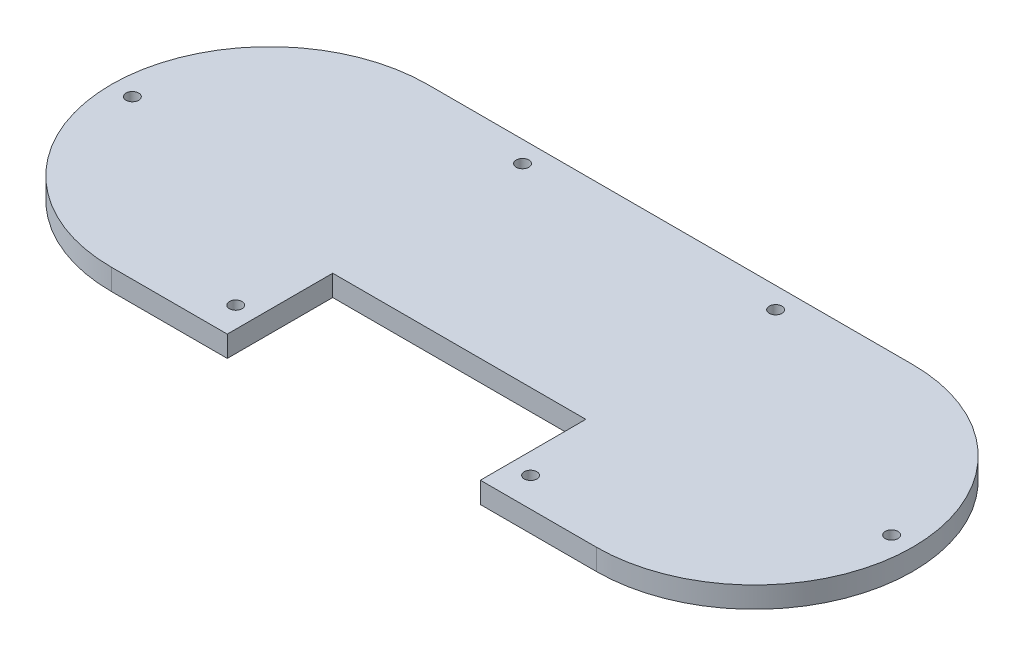
from build123d import *

# Parameters (mm, degrees)
SKETCH1_R  = 1.5
BODY_DEPTH = 5


with BuildPart() as part:
    # Sketch1 → body (new body)
    with BuildSketch(Plane(origin=(0, 0, 0), x_dir=(1, 0, 0), z_dir=(0, 1, 0))):
        with BuildLine():
            Line((-57.5, 37.5), (57.5, 37.5))
            ThreePointArc((57.5, 37.5), (95, 0), (57.5, -37.5))
            Line((57.5, -37.5), (30, -37.5))
            Line((30, -37.5), (30, -12.5))
            Line((30, -12.5), (-30, -12.5))
            Line((-30, -12.5), (-30, -37.5))
            Line((-30, -37.5), (-57.5, -37.5))
            ThreePointArc((-57.5, -37.5), (-95, 0), (-57.5, 37.5))
        make_face()
        with Locations((-90, 0)):
            Circle(SKETCH1_R, mode=Mode.SUBTRACT)
        with Locations((-30, 32.5)):
            Circle(SKETCH1_R, mode=Mode.SUBTRACT)
        with Locations((30, 32.5)):
            Circle(SKETCH1_R, mode=Mode.SUBTRACT)
        with Locations((90, 0)):
            Circle(SKETCH1_R, mode=Mode.SUBTRACT)
        with Locations((34.949747468, -30.550252532)):
            Circle(SKETCH1_R, mode=Mode.SUBTRACT)
        with Locations((-34.949747468, -30.550252532)):
            Circle(SKETCH1_R, mode=Mode.SUBTRACT)
    extrude(amount=BODY_DEPTH)


solid = part.part
